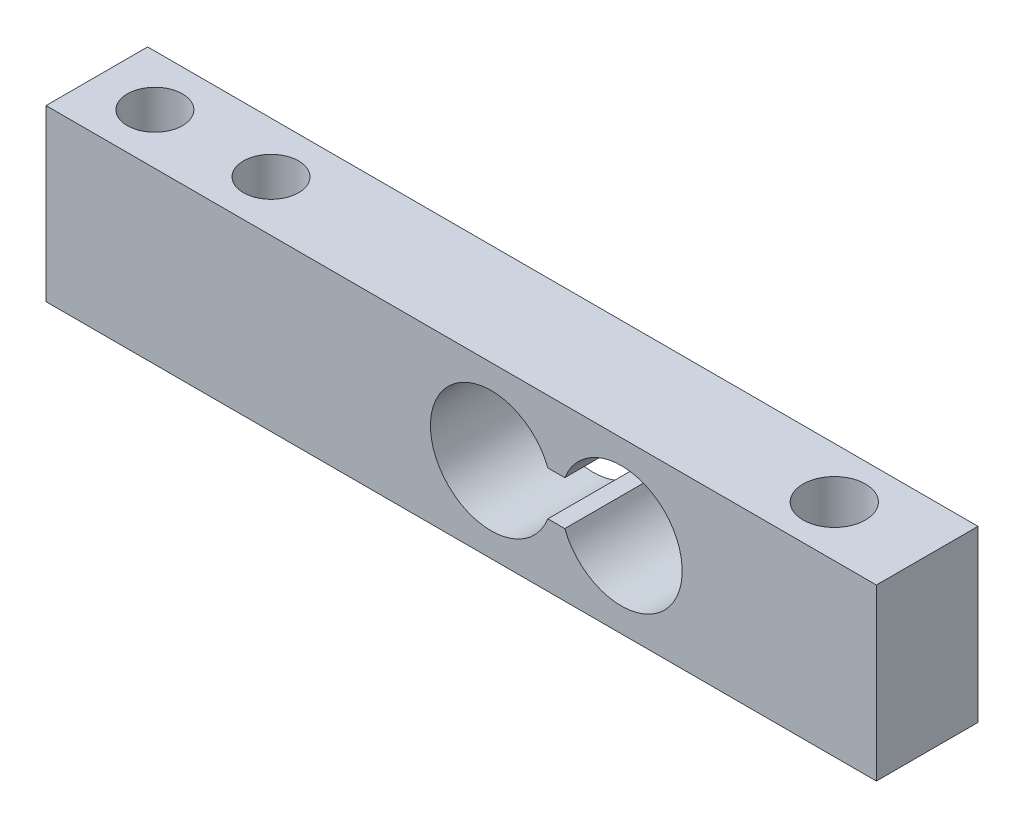
from build123d import *

# Parameters (mm, degrees)
SKETCH1_W               = 57.2
SKETCH1_H               = 11.7
BOSS_EXTRUDE1_DEPTH     = 7
CUT_EXTRUDE1_DEPTH      = 59.802465935
CUT_EXTRUDE1_DEPTH_BACK = 59.802465935
SKETCH2_R               = 2.15
SKETCH2_R_2             = 1.9
CUT_EXTRUDE2_DEPTH      = 59.802465935


with BuildPart() as part:
    # Sketch1 → Boss-Extrude1 (new body)
    with BuildSketch(Plane.XY):
        with Locations((28.6, 5.85)):
            Rectangle(SKETCH1_W, SKETCH1_H)
    extrude(amount=BOSS_EXTRUDE1_DEPTH)

    # Sketch2 → Cut-Extrude1 (cut, two sides: drawn at the far end of the back side and taken through both)
    with BuildSketch(Plane(origin=(0, 11.7, 0), x_dir=(1, 0, 0), z_dir=(0, 1, 0)).offset(-CUT_EXTRUDE1_DEPTH_BACK)):
        with Locations((50.8, -3.5)):
            Circle(SKETCH2_R)
        with Locations((4, -3.5)):
            Circle(SKETCH2_R_2)
        with Locations((12, -3.5)):
            Circle(SKETCH2_R_2)
    extrude(amount=CUT_EXTRUDE1_DEPTH + CUT_EXTRUDE1_DEPTH_BACK, mode=Mode.SUBTRACT)

    # Sketch3 → Cut-Extrude2 (cut, through all)
    with BuildSketch(Plane.XY.offset(7)):
        with BuildLine():
            Line((34.57071198, 7.367429549), (35.734206681, 7.367429549))
            ThreePointArc((35.734206681, 7.367429549), (43.82348168, 5.85), (35.734206681, 4.332570451))
            Line((35.734206681, 4.332570451), (34.57071198, 4.332570451))
            ThreePointArc((34.57071198, 4.332570451), (26.48143698, 5.85), (34.57071198, 7.367429549))
        make_face()
    extrude(amount=-CUT_EXTRUDE2_DEPTH, mode=Mode.SUBTRACT)


solid = part.part
